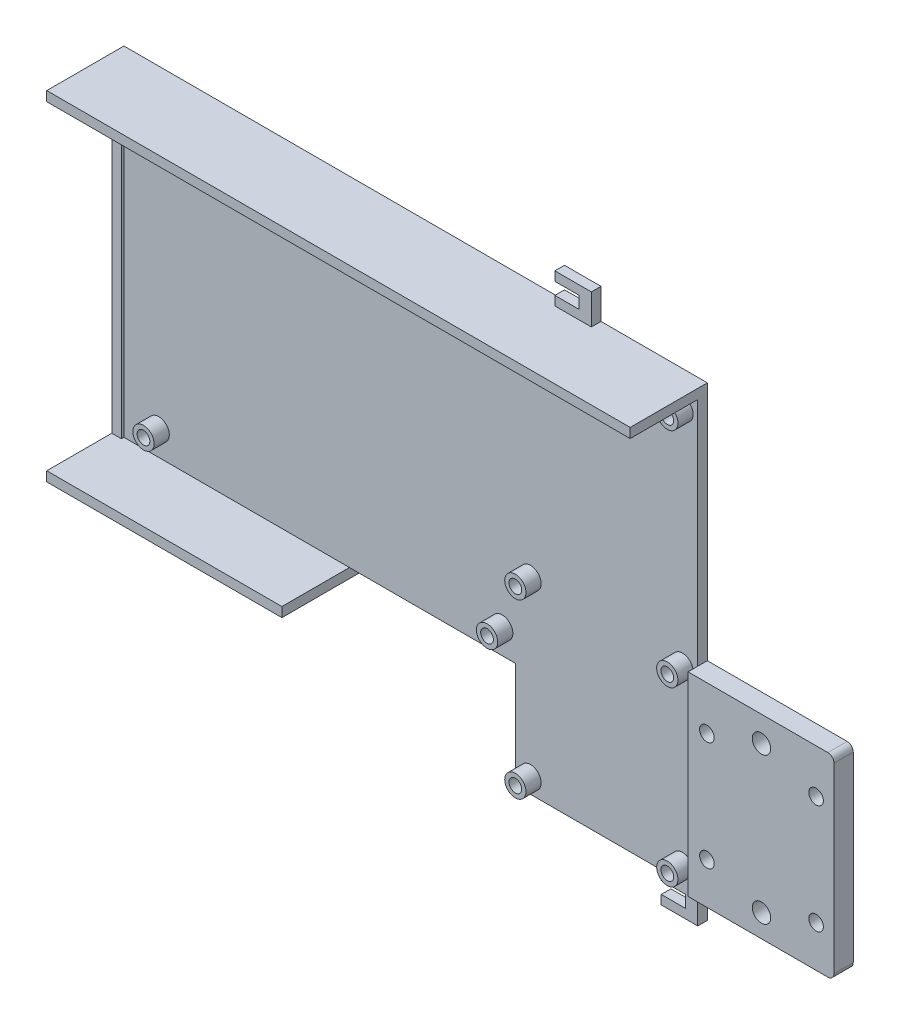
from build123d import *

# Parameters (mm, degrees)
SKETCH2_R              = 3.5
SKETCH2_R_2            = 2.0955
BOSS_EXTRUDE1_DEPTH    = 5
BOSS_EXTRUDE1_2_DEPTH  = 5
SKETCH2_R_3            = 2.1
BOSS_EXTRUDE1_3_DEPTH  = 5
BOSS_EXTRUDE1_4_DEPTH  = 5
BOSS_EXTRUDE1_5_DEPTH  = 5
BOSS_EXTRUDE1_6_DEPTH  = 5
BOSS_EXTRUDE1_7_DEPTH  = 5
BOSS_EXTRUDE1_8_DEPTH  = 5
BOSS_EXTRUDE1_9_DEPTH  = 5
BOSS_EXTRUDE1_10_DEPTH = 5
BOSS_EXTRUDE2_DEPTH    = 3.175
BOSS_EXTRUDE3_DEPTH    = 25.4
BOSS_EXTRUDE4_DEPTH    = 16
BOSS_EXTRUDE5_DEPTH    = 3.175
BOSS_EXTRUDE6_DEPTH    = 25.4
SKETCH4_5_W            = 3.175
SKETCH4_5_H            = 105.156
BOSS_EXTRUDE7_DEPTH    = 4
BOSS_EXTRUDE8_DEPTH    = 3.175
SKETCH9_W              = 48
SKETCH9_H              = 64
BOSS_EXTRUDE10_DEPTH   = 6.35
SKETCH10_R             = 2.4
SKETCH10_R_2           = 3.025
CUT_EXTRUDE1_DEPTH     = 5
FILLET1_R              = 2


with BuildPart() as part:
    # Sketch2 → Boss-Extrude1 (new body)
    with BuildSketch(Plane(origin=(0, 0, -17.088306879), x_dir=(-1, 0, 0), z_dir=(0, 0, -1))):
        with Locations((34.936475828, 161.386626861)):
            Circle(SKETCH2_R)
        with Locations((34.936475828, 161.386626861)):
            Circle(SKETCH2_R_2, mode=Mode.SUBTRACT)
    extrude(amount=BOSS_EXTRUDE1_DEPTH)



with BuildPart() as body_2:
    # Sketch2 → Boss-Extrude1 2 (new body)
    with BuildSketch(Plane(origin=(0, 0, -17.088306879), x_dir=(-1, 0, 0), z_dir=(0, 0, -1))):
        with Locations((84.936475828, 161.386626861)):
            Circle(SKETCH2_R)
        with Locations((84.936475828, 161.386626861)):
            Circle(SKETCH2_R_2, mode=Mode.SUBTRACT)
    extrude(amount=BOSS_EXTRUDE1_2_DEPTH)


with BuildPart() as body_3:
    # Sketch2 → Boss-Extrude1 3 (new body)
    with BuildSketch(Plane(origin=(0, 0, -17.088306879), x_dir=(-1, 0, 0), z_dir=(0, 0, -1))):
        with Locations((94.254475828, 162.322626861)):
            Circle(SKETCH2_R)
        with Locations((94.254475828, 162.322626861)):
            Circle(SKETCH2_R_3, mode=Mode.SUBTRACT)
    extrude(amount=BOSS_EXTRUDE1_3_DEPTH)


with BuildPart() as body_4:
    # Sketch2 → Boss-Extrude1 4 (new body)
    with BuildSketch(Plane(origin=(0, 0, -17.088306879), x_dir=(-1, 0, 0), z_dir=(0, 0, -1))):
        with Locations((207.284475828, 162.322626861)):
            Circle(SKETCH2_R)
        with Locations((207.284475828, 162.322626861)):
            Circle(SKETCH2_R_3, mode=Mode.SUBTRACT)
    extrude(amount=BOSS_EXTRUDE1_4_DEPTH)


with BuildPart() as body_5:
    # Sketch2 → Boss-Extrude1 5 (new body)
    with BuildSketch(Plane(origin=(0, 0, -17.088306879), x_dir=(-1, 0, 0), z_dir=(0, 0, -1))):
        with Locations((34.936475828, 88.136626861)):
            Circle(SKETCH2_R)
        with Locations((34.936475828, 88.136626861)):
            Circle(SKETCH2_R_2, mode=Mode.SUBTRACT)
    extrude(amount=BOSS_EXTRUDE1_5_DEPTH)


with BuildPart() as body_6:
    # Sketch2 → Boss-Extrude1 6 (new body)
    with BuildSketch(Plane(origin=(0, 0, -17.088306879), x_dir=(-1, 0, 0), z_dir=(0, 0, -1))):
        with Locations((34.936475828, 31.386626861)):
            Circle(SKETCH2_R)
        with Locations((34.936475828, 31.386626861)):
            Circle(SKETCH2_R_2, mode=Mode.SUBTRACT)
    extrude(amount=BOSS_EXTRUDE1_6_DEPTH)


with BuildPart() as body_7:
    # Sketch2 → Boss-Extrude1 7 (new body)
    with BuildSketch(Plane(origin=(0, 0, -17.088306879), x_dir=(-1, 0, 0), z_dir=(0, 0, -1))):
        with Locations((84.936475828, 31.386626861)):
            Circle(SKETCH2_R)
        with Locations((84.936475828, 31.386626861)):
            Circle(SKETCH2_R_2, mode=Mode.SUBTRACT)
    extrude(amount=BOSS_EXTRUDE1_7_DEPTH)


with BuildPart() as body_8:
    # Sketch2 → Boss-Extrude1 8 (new body)
    with BuildSketch(Plane(origin=(0, 0, -17.088306879), x_dir=(-1, 0, 0), z_dir=(0, 0, -1))):
        with Locations((84.936475828, 88.136626861)):
            Circle(SKETCH2_R)
        with Locations((84.936475828, 88.136626861)):
            Circle(SKETCH2_R_2, mode=Mode.SUBTRACT)
    extrude(amount=BOSS_EXTRUDE1_8_DEPTH)


with BuildPart() as body_9:
    # Sketch2 → Boss-Extrude1 9 (new body)
    with BuildSketch(Plane(origin=(0, 0, -17.088306879), x_dir=(-1, 0, 0), z_dir=(0, 0, -1))):
        with Locations((94.254475828, 69.358626861)):
            Circle(SKETCH2_R)
        with Locations((94.254475828, 69.358626861)):
            Circle(SKETCH2_R_3, mode=Mode.SUBTRACT)
    extrude(amount=BOSS_EXTRUDE1_9_DEPTH)


with BuildPart() as body_10:
    # Sketch2 → Boss-Extrude1 10 (new body)
    with BuildSketch(Plane(origin=(0, 0, -17.088306879), x_dir=(-1, 0, 0), z_dir=(0, 0, -1))):
        with Locations((207.284475828, 69.358626861)):
            Circle(SKETCH2_R)
        with Locations((207.284475828, 69.358626861)):
            Circle(SKETCH2_R_3, mode=Mode.SUBTRACT)
    extrude(amount=BOSS_EXTRUDE1_10_DEPTH)


with BuildPart() as part_1:
    add(part.part)

    add(body_2.part)  # Boss-Extrude2 merges body 2

    add(body_3.part)  # Boss-Extrude2 merges body 3

    add(body_4.part)  # Boss-Extrude2 merges body 4

    add(body_5.part)  # Boss-Extrude2 merges body 5

    add(body_6.part)  # Boss-Extrude2 merges body 6

    add(body_7.part)  # Boss-Extrude2 merges body 7

    add(body_8.part)  # Boss-Extrude2 merges body 8

    add(body_9.part)  # Boss-Extrude2 merges body 9

    add(body_10.part)  # Boss-Extrude2 merges body 10
    # Sketch3 → Boss-Extrude2 (add)
    with BuildSketch(Plane(origin=(0, 0, -22.088306879), x_dir=(-1, 0, 0), z_dir=(0, 0, -1))):
        Polygon((29.936475828, 166.386626861), (218.714475828, 166.386626861), (218.714475828, 61.230626861), (89.936475828, 61.230626861), (89.936475828, 26.386626861), (29.936475828, 26.386626861), (29.936475828, 61.230626861), align=None)
    extrude(amount=BOSS_EXTRUDE2_DEPTH)

    # Sketch4 → Boss-Extrude3 (add)
    with BuildSketch(Plane(origin=(0, 0, -25.263306879), x_dir=(-1, 0, 0), z_dir=(0, 0, -1))):
        Polygon((221.889475828, 61.230626861), (218.714475828, 61.230626861), (144.520113107, 61.230626861), (144.520113107, 58.055626861), (221.889475828, 58.055626861), align=None)
    extrude(amount=-BOSS_EXTRUDE3_DEPTH)

    # Sketch4<3> → Boss-Extrude4 (add)
    with BuildSketch(Plane(origin=(0, 0, -25.263306879), x_dir=(-1, 0, 0), z_dir=(0, 0, -1))):
        Polygon((144.520113107, 61.230626861), (144.520113107, 58.055626861), (221.889475828, 58.055626861), (221.889475828, 61.230626861), (218.714475828, 61.230626861), align=None)
    extrude(amount=-BOSS_EXTRUDE4_DEPTH)

    # Sketch5 → Boss-Extrude5 (add)
    with BuildSketch(Plane(origin=(0, 0, -25.263306879), x_dir=(-1, 0, 0), z_dir=(0, 0, -1))):
        Polygon((166.051482846, 58.055626861), (166.051482846, 48.055626861), (178.051482846, 48.055626861), (178.051482846, 51.055626861), (170.051482846, 51.055626861), (170.051482846, 55.055626861), (178.051482846, 55.055626861), (178.051482846, 58.055626861), align=None)
    extrude(amount=-BOSS_EXTRUDE5_DEPTH)

    # Sketch4<4> → Boss-Extrude6 (add)
    with BuildSketch(Plane(origin=(0, 0, -25.263306879), x_dir=(-1, 0, 0), z_dir=(0, 0, -1))):
        Polygon((29.936475828, 169.561626861), (29.936475828, 166.386626861), (218.714475828, 166.386626861), (221.889475828, 166.386626861), (221.889475828, 169.561626861), align=None)
    extrude(amount=-BOSS_EXTRUDE6_DEPTH)

    # Sketch4<5> → Boss-Extrude7 (add)
    with BuildSketch(Plane(origin=(0, 0, -25.263306879), x_dir=(-1, 0, 0), z_dir=(0, 0, -1))):
        with Locations((220.301975828, 113.808626861)):
            Rectangle(SKETCH4_5_W, SKETCH4_5_H)
    extrude(amount=-BOSS_EXTRUDE7_DEPTH)

    # Sketch6 → Boss-Extrude8 (add)
    with BuildSketch(Plane(origin=(0, 0, -25.263306879), x_dir=(-1, 0, 0), z_dir=(0, 0, -1))):
        Polygon((64.936475828, 169.561626861), (76.936475828, 169.561626861), (76.936475828, 172.561626861), (68.936475828, 172.561626861), (68.936475828, 176.561626861), (76.936475828, 176.561626861), (76.936475828, 179.561626861), (64.936475828, 179.561626861), align=None)
        Polygon((41.936475828, 26.386626861), (29.936475828, 26.386626861), (29.936475828, 16.386626861), (41.936475828, 16.386626861), (41.936475828, 19.386626861), (33.936475828, 19.386626861), (33.936475828, 23.386626861), (41.936475828, 23.386626861), align=None)
    extrude(amount=-BOSS_EXTRUDE8_DEPTH)

    # Sketch9 → Boss-Extrude10 (add)
    with BuildSketch(Plane(origin=(0, 0, -25.263306879), x_dir=(-1, 0, 0), z_dir=(0, 0, -1))):
        with Locations((5.936475828, 58.386626861)):
            Rectangle(SKETCH9_W, SKETCH9_H)
    extrude(amount=-BOSS_EXTRUDE10_DEPTH)

    # Sketch10 → Cut-Extrude1 (cut)
    with BuildSketch(Plane.XY.offset(-18.913306879)):
        with Locations((12.182443358, 75.91563214)):
            Circle(SKETCH10_R)
        with Locations((-23.738581126, 75.91563214)):
            Circle(SKETCH10_R)
        with Locations((-23.738581126, 39.994607656)):
            Circle(SKETCH10_R)
        with Locations((12.182443358, 39.994607656)):
            Circle(SKETCH10_R)
        with Locations((-5.778068884, 33.867170892)):
            Circle(SKETCH10_R_2)
        with Locations((-5.778068884, 82.043068904)):
            Circle(SKETCH10_R_2)
    extrude(amount=-CUT_EXTRUDE1_DEPTH, mode=Mode.SUBTRACT)

    # Fillet1
    fillet1_edges = [part_1.edges().sort_by_distance(p)[0] for p in [
        (18.063524172, 90.386626861, -22.088306879),
        (18.063524172, 26.386626861, -22.088306879),
        (-89.936475828, 26.386626861, -23.675806879),
    ]]
    fillet(fillet1_edges, radius=FILLET1_R)


solid = part_1.part
